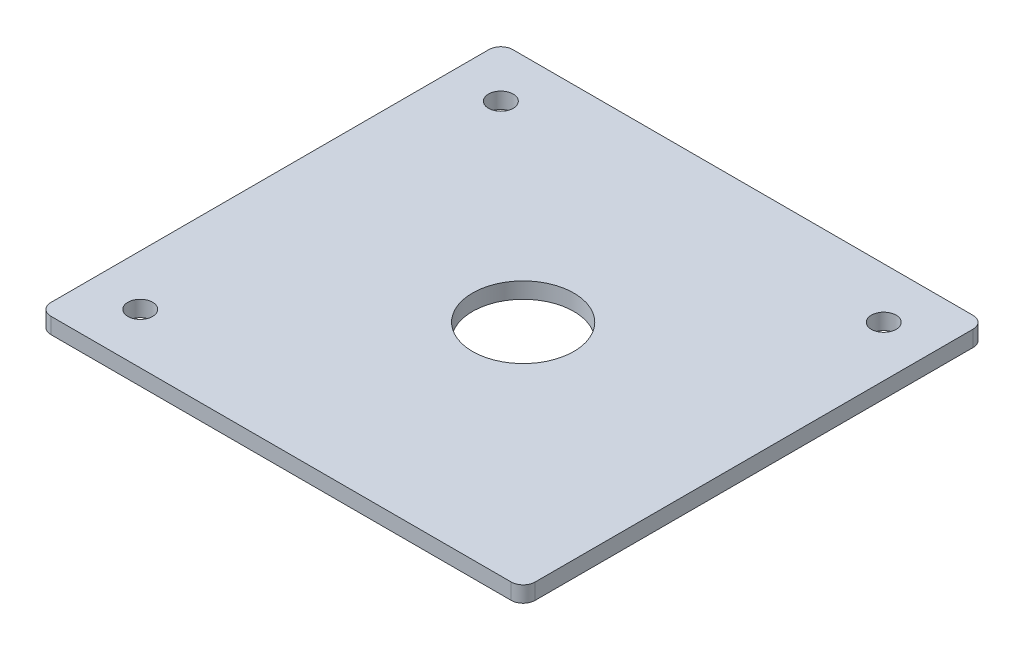
from build123d import *

# Parameters (mm, degrees)
SKETCH1_W           = 121.4
SKETCH1_H           = 115.8
SKETCH1_R           = 12.7
SKETCH1_R_2         = 3.1
BOSS_EXTRUDE1_DEPTH = 4
FILLET1_R           = 3


with BuildPart() as part:
    # Sketch1 → Boss-Extrude1 (new body)
    with BuildSketch(Plane(origin=(0, 0, 0), x_dir=(1, 0, 0), z_dir=(0, 1, 0))):
        with Locations((61.417527055, -57.9)):
            Rectangle(SKETCH1_W, SKETCH1_H)
        with Locations((64.217527055, -57.9)):
            Circle(SKETCH1_R, mode=Mode.SUBTRACT)
        with Locations((13.417527055, -12.7)):
            Circle(SKETCH1_R_2, mode=Mode.SUBTRACT)
        with Locations((109.417527055, -12.7)):
            Circle(SKETCH1_R_2, mode=Mode.SUBTRACT)
        with Locations((13.417527055, -103.1)):
            Circle(SKETCH1_R_2, mode=Mode.SUBTRACT)
    extrude(amount=BOSS_EXTRUDE1_DEPTH)

    # Fillet1
    fillet1_edges = [part.edges().sort_by_distance(p)[0] for p in [
        (122.117527055, 2, 0),
        (122.117527055, 2, 115.8),
        (0.717527055, 2, 115.8),
        (0.717527055, 2, 0),
    ]]
    fillet(fillet1_edges, radius=FILLET1_R)


solid = part.part
